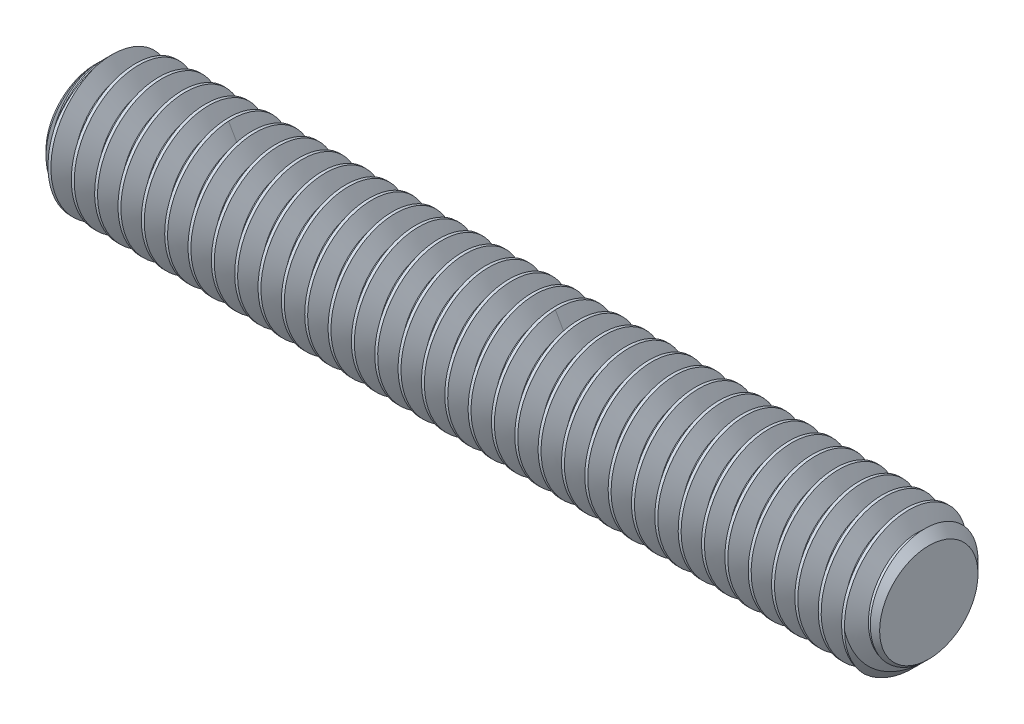
from build123d import *

# Parameters (mm, degrees)
BOSS_EXTRUDE1_DEPTH      = 12.5
BOSS_EXTRUDE1_DEPTH_BACK = 12.5
SKETCH2_R                = 2
CHAMFER1_SIZE            = 0.525
CUT_SWEEP3_PITCH         = 0.7
LPATTERN1_COUNT          = 4
LPATTERN1_PITCH          = 9.8


with BuildPart() as part:
    # Sketch2 → Boss-Extrude1 (new, two sides: drawn at the far end of the back side and taken through both)
    with BuildSketch(Plane(origin=(0, 0, 0), x_dir=(0, 0, -1), z_dir=(1, 0, 0)).offset(-BOSS_EXTRUDE1_DEPTH_BACK)):
        Circle(SKETCH2_R)
    extrude(amount=BOSS_EXTRUDE1_DEPTH + BOSS_EXTRUDE1_DEPTH_BACK)

    # Chamfer1
    chamfer1_edges = [part.edges().sort_by_distance(p)[0] for p in [
        (-12.5, 0, 2),
        (12.5, 0, 2),
    ]]
    chamfer(chamfer1_edges, length=CHAMFER1_SIZE)

    # Cut-Sweep3: the profile of Sketch4 screwed along a right-hand helix of 16 turns, 6 arcs to a turn; built about Z, then put on its axis
    cut_sweep3_z = Axis((0, 0, 0), (0, 0, 1))
    cut_sweep3_corners = [(1.545336663, 0, -0.2625), (2.037888611, 0, 0.021875), (2.037888611, 0, -0.634375), (1.545336663, 0, -0.35)]
    with BuildLine(mode=Mode.PRIVATE) as cut_sweep3_profile:
        Line(cut_sweep3_corners[0], cut_sweep3_corners[1])
        Line(cut_sweep3_corners[1], cut_sweep3_corners[2])
        Line(cut_sweep3_corners[2], cut_sweep3_corners[3])
        Line(cut_sweep3_corners[3], cut_sweep3_corners[0])
    cut_sweep3_cap = Face(cut_sweep3_profile.wire())
    cut_sweep3_turn_angles = [0, 30, 60, 90, 120, 150, 180, 210, 240, 270, 300, 330, 360]
    cut_sweep3_turn_weights = [1, 0.8660254037844387, 1, 0.8660254037844387, 1, 0.8660254037844387, 1, 0.8660254037844387, 1, 0.8660254037844387, 1, 0.8660254037844387, 1]
    cut_sweep3_turn_rails = [Edge.make_bspline([Vector(p[0], p[1], 0).rotate(cut_sweep3_z, cut_sweep3_turn_angles[k]) / cut_sweep3_turn_weights[k] + Vector(0, 0, p[2] + CUT_SWEEP3_PITCH * cut_sweep3_turn_angles[k] / 360) for k in range(13)], [0, 0, 0, 1, 1, 2, 2, 3, 3, 4, 4, 5, 5, 6, 6, 6], 2, cut_sweep3_turn_weights) for p in cut_sweep3_corners]
    cut_sweep3_turn_sides = [Face.make_surface_from_curves(cut_sweep3_turn_rails[p[0]], cut_sweep3_turn_rails[p[1]]) for p in [(0, 1), (1, 2), (2, 3), (3, 0)]]
    cut_sweep3 = Plane(origin=(12.5, 0, 0), x_dir=(0, 1, 0), z_dir=(-1, 0, 0)) * Solid(Shell([*[p.moved(Location((0, 0, CUT_SWEEP3_PITCH * i))) for i in range(16) for p in cut_sweep3_turn_sides], cut_sweep3_cap, cut_sweep3_cap.rotate(cut_sweep3_z, 5760).moved(Location((0, 0, CUT_SWEEP3_PITCH * 5760 / 360)))]))
    add(cut_sweep3, mode=Mode.SUBTRACT)

    # LPattern1: Cut-Sweep3 ×4
    with Locations(*[(-i * LPATTERN1_PITCH, 0, 0) for i in range(1, LPATTERN1_COUNT)]):
        add(cut_sweep3, mode=Mode.SUBTRACT)


solid = part.part
